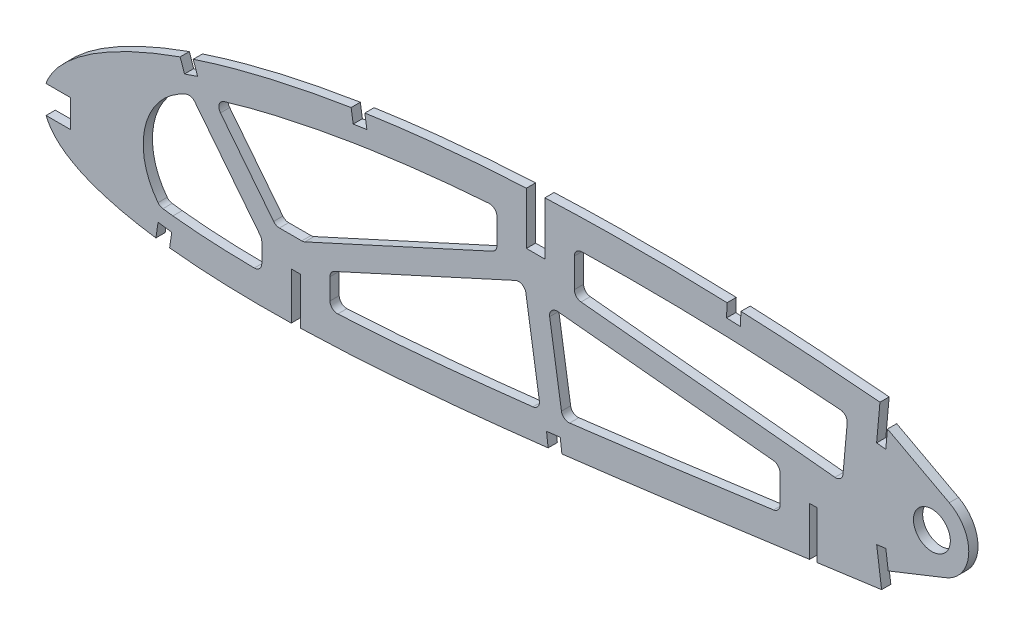
from build123d import *

# Parameters (mm, degrees)
BOSS_EXTRUDE1_DEPTH = 3.175
CUT_EXTRUDE1_DEPTH  = 7.62
SKETCH3_R           = 6.35
CUT_EXTRUDE2_DEPTH  = 7.62
CUT_EXTRUDE3_DEPTH  = 477.963187519
CUT_EXTRUDE4_START  = -3.175
CUT_EXTRUDE4_DEPTH  = 3.175
FILLET1_R           = 2.54


# Read off the part's stored shape, not the designer's step: Cut-Extrude4
with BuildPart() as part:
    # Sketch1 → Boss-Extrude1 (new body)
    with BuildSketch(Plane.XY):
        with BuildLine():
            Line((468.834634376, -0.731838708), (473.237631437, -1.626460605))
            Line((473.237631437, -1.626460605), (469.420105342, 0.731838708))
            add(Edge.make_bspline(
                [(469.420105342, 0.731838708), (469.384144743, 0.75405358), (469.240441949, 0.842826831), (468.916653521, 1.041434293), (468.377478456, 1.372225024), (467.622680377, 1.832901279), (466.652845475, 2.422239826), (465.467485908, 3.136113979), (464.067341521, 3.972204372), (462.452751187, 4.926556606), (460.623880493, 5.99470234), (458.581425768, 7.172314172), (456.325564704, 8.452725095), (453.857171213, 9.830703338), (451.177092175, 11.299695359), (448.285834578, 12.853066351), (445.184433662, 14.482914856), (441.87408004, 16.182230896), (438.355377166, 17.941630348), (434.629984045, 19.753790881), (430.699141968, 21.609677497), (426.564192467, 23.499388025), (422.22751115, 25.41521975), (417.69029685, 27.345261464), (412.955135305, 29.281151436), (408.024042449, 31.211871947), (402.899937976, 33.12863011), (397.58479872, 35.019008566), (392.082597846, 36.874746386), (386.396004495, 38.68378787), (380.529085336, 40.436308543), (374.485249168, 42.120945686), (368.269534158, 43.72905958), (361.885882446, 45.248939331), (355.339704572, 46.670411418), (348.63620397, 47.984917711), (341.781002635, 49.179334611), (334.793097003, 50.252730987), (327.784920922, 51.145614984), (320.79116359, 52.021329621), (313.807821665, 52.843983365), (306.739128647, 53.631788144), (299.591885106, 54.380308437), (292.373180531, 55.087203561), (285.090322746, 55.749422771), (277.750880063, 56.365023912), (270.361954303, 56.930518839), (262.931336863, 57.445036287), (255.466373755, 57.904053071), (247.975016147, 58.307224442), (240.464868712, 58.651738691), (232.943747029, 58.935221873), (225.419637453, 59.155962801), (217.900350262, 59.311846649), (210.394026923, 59.401893322), (202.908475182, 59.423642443), (195.451832721, 59.376704816), (188.031907868, 59.259468925), (180.656846602, 59.07032975), (173.334467891, 58.808934388), (166.072689758, 58.475396129), (158.879463115, 58.066921878), (151.76259133, 57.586114694), (144.729999608, 57.030954849), (137.789414782, 56.401294687), (130.948110641, 55.699758895), (124.213703919, 54.924439317), (117.593411838, 54.077542083), (111.094475675, 53.160727588), (104.72418742, 52.173496373), (98.489371058, 51.118700137), (92.396755747, 49.997417995), (86.452787451, 48.81293722), (80.663937566, 47.565566874), (75.036333929, 46.259048591), (69.57582504, 44.895658843), (64.288280855, 43.477893405), (59.179061403, 42.009154361), (54.253333229, 40.492773824), (49.516838534, 38.930418047), (44.973157087, 37.328010693), (40.627870346, 35.686689303), (36.484306892, 34.011510412), (32.547322707, 32.304761192), (28.819858841, 30.571644792), (25.306133953, 28.814134252), (22.008652271, 27.037153572), (18.930724245, 25.243427453), (16.07531265, 23.436287722), (13.44361768, 21.620318123), (11.039267644, 19.796658613), (8.863088517, 17.969917436), (6.916457434, 16.142876281), (5.20215694, 14.316793669), (3.720125296, 12.494885385), (2.472304781, 10.678594294), (1.458911867, 8.869639065), (0.682238714, 7.069333725), (0.141515122, 5.278690749), (-0.154473369, 3.500353053), (-0.228146672, 1.732894981), (-0.07593526, 0.576768576), (0, 0)],
                knots=[0, 0, 0, 0, 0.00025409, 0.001015373, 0.002283359, 0.004056577, 0.006330982, 0.009105274, 0.012374489, 0.016134023, 0.020379661, 0.025105976, 0.030306237, 0.035972206, 0.042099522, 0.048678064, 0.055701664, 0.063160184, 0.071045824, 0.079349827, 0.08806291, 0.097175757, 0.106678111, 0.116561573, 0.126814276, 0.137428301, 0.148393618, 0.15969976, 0.171338125, 0.183297699, 0.195569604, 0.208143556, 0.221011593, 0.234161831, 0.24758745, 0.261276822, 0.27522271, 0.289414144, 0.3037712, 0.317689226, 0.331784111, 0.346039677, 0.36044387, 0.374982721, 0.389640454, 0.404403317, 0.4192566, 0.434186749, 0.449177265, 0.464214782, 0.479284009, 0.49436974, 0.509457833, 0.524532346, 0.53957932, 0.554582984, 0.569529546, 0.584403417, 0.599190992, 0.613876838, 0.628447475, 0.642888675, 0.657186054, 0.671325546, 0.685294014, 0.699078147, 0.712665095, 0.726042645, 0.739197713, 0.752117586, 0.764792042, 0.777208152, 0.789355685, 0.80122396, 0.812803686, 0.824082909, 0.835054602, 0.845709571, 0.856037853, 0.866033834, 0.875688843, 0.884997719, 0.893953426, 0.902552897, 0.910789386, 0.918660734, 0.926166253, 0.933302626, 0.94007122, 0.94647478, 0.952517526, 0.958204819, 0.963546652, 0.9685566, 0.973249913, 0.977651041, 0.981787043, 0.985694226, 0.989415109, 0.993001157, 0.996508416, 1, 1, 1, 1], degree=3))
            add(Edge.make_bspline(
                [(0, 0), (0.120545422, -0.569054782), (0.362190271, -1.709779619), (1.018707782, -3.35195076), (1.886920844, -4.930552911), (2.985051288, -6.441392915), (4.305797565, -7.884057869), (5.846242644, -9.260048331), (7.604875869, -10.568624397), (9.57939547, -11.809190578), (11.766933151, -12.983063792), (14.165030149, -14.089514173), (16.771499867, -15.128195969), (19.583502489, -16.097720727), (22.597600275, -16.999564994), (25.810927556, -17.83153108), (29.219830482, -18.594781746), (32.82103031, -19.287368785), (36.610602861, -19.909995783), (40.584611298, -20.462314276), (44.738976581, -20.94466978), (49.069622971, -21.356050059), (53.572267018, -21.697340041), (58.242420882, -21.968766107), (63.07555133, -22.171188915), (68.067028727, -22.30383895), (73.21196449, -22.368784292), (78.505709034, -22.366999873), (83.943083827, -22.298008468), (89.519444052, -22.165621357), (95.229438588, -21.969000009), (101.06791245, -21.710523747), (107.029599259, -21.392793842), (113.109152024, -21.016887343), (119.301220533, -20.584470276), (125.600428387, -20.099010447), (132.001053313, -19.561718629), (138.497513135, -18.97572672), (145.084056477, -18.343968166), (151.754992696, -17.668442476), (158.504433487, -16.952327301), (165.326367256, -16.197943271), (172.214990615, -15.40931492), (179.164010856, -14.587869186), (186.167551809, -13.738296088), (193.219024932, -12.862218898), (200.312533746, -11.963011893), (207.44169833, -11.044909074), (214.599844565, -10.107805674), (221.780951957, -9.158378258), (228.978095261, -8.195844739), (236.185009877, -7.225155571), (243.39502444, -6.249327898), (250.601116302, -5.268662037), (257.796951099, -4.287222096), (264.975853334, -3.307702419), (272.13079123, -2.33019238), (279.255291474, -1.35955068), (286.342179994, -0.395658656), (293.38492181, 0.559529456), (300.37676799, 1.503162571), (307.311122172, 2.434049592), (314.180831105, 3.351601668), (320.978983246, 4.256163344), (327.596964914, 5.120278953), (334.01748331, 5.989962795), (340.262174398, 6.702910859), (346.429111082, 7.311437642), (352.524699362, 7.810345682), (358.541619746, 8.206812681), (364.472978221, 8.503671562), (370.311705825, 8.705066897), (376.050427401, 8.816973355), (381.681975143, 8.842230751), (387.198662126, 8.788893941), (392.593313409, 8.66126226), (397.85839984, 8.46506453), (402.98657623, 8.20692007), (407.970558399, 7.89386613), (412.802863889, 7.530520429), (417.476759125, 7.125365523), (421.985033014, 6.684332445), (426.320762922, 6.212460013), (430.477622429, 5.719635759), (434.44895803, 5.209104646), (438.228796305, 4.68925635), (441.811052689, 4.165359017), (445.190053843, 3.644101417), (448.360490845, 3.130455994), (451.317242447, 2.631240452), (454.055677032, 2.151118888), (456.571042556, 1.694780117), (458.859849552, 1.267981745), (460.917577703, 0.872844052), (462.741474942, 0.515878932), (464.328149845, 0.198661447), (465.675276413, -0.074339095), (466.780502068, -0.302045374), (467.642148233, -0.480719316), (468.258513042, -0.610646491), (468.628929808, -0.68795975), (468.793510743, -0.723066602), (468.834634376, -0.731838708)],
                knots=[0, 0, 0, 0, 0.003638255, 0.007293231, 0.011028136, 0.014901081, 0.018963272, 0.023258475, 0.027820626, 0.032679082, 0.03785316, 0.043361875, 0.049214679, 0.055422346, 0.061988786, 0.068918036, 0.076211157, 0.083868392, 0.091887411, 0.100265912, 0.108999867, 0.118084529, 0.127514843, 0.13728527, 0.147387917, 0.157816481, 0.168563473, 0.179619128, 0.190977373, 0.202626974, 0.214560478, 0.226767249, 0.239236417, 0.251959004, 0.264923894, 0.278119703, 0.291536035, 0.30516028, 0.318980685, 0.332985499, 0.34716279, 0.361498603, 0.375980747, 0.390597192, 0.405332593, 0.420174823, 0.435109533, 0.450124276, 0.465203068, 0.480333154, 0.495500583, 0.510689775, 0.525887334, 0.541078314, 0.556247233, 0.571381785, 0.58646604, 0.601484516, 0.616424329, 0.631269423, 0.646006524, 0.660620684, 0.675098188, 0.689422858, 0.703581824, 0.716907564, 0.730009274, 0.742952128, 0.755725558, 0.768319952, 0.780724337, 0.792926528, 0.804916041, 0.816679084, 0.828203524, 0.8394749, 0.850481359, 0.861207697, 0.871639326, 0.881763414, 0.891563605, 0.901027364, 0.910138977, 0.918883976, 0.927249278, 0.935221104, 0.942784738, 0.949928188, 0.956638464, 0.962904204, 0.968712288, 0.974054485, 0.978918432, 0.983297218, 0.987180246, 0.990560674, 0.993433357, 0.995790626, 0.997629587, 0.998945816, 0.999736592, 1, 1, 1, 1], degree=3))
        make_face()
    extrude(amount=BOSS_EXTRUDE1_DEPTH)

    # Sketch2 → Cut-Extrude1 (cut)
    with BuildSketch(Plane(origin=(0, 0, 0), x_dir=(-1, 0, 0), z_dir=(0, 0, -1))):
        Polygon((-263.563721968, 13.219982977), (-263.563721968, -3.189971143), (-263.563721968, -3.825357456), (-266.103721968, -4.091779691), (-266.103721968, -3.189971143), (-266.103721968, 13.219982977), align=None)
        Polygon((-166.091221968, 58.764877443), (-166.091221968, 40.486653506), (-172.441221968, 40.486653506), (-172.441221968, 58.764877443), (-172.441221968, 60.571266296), (-166.091221968, 59.668071869), align=None)
        Polygon((-85.128721968, -6.092674639), (-85.128721968, -21.703698708), (-85.128721968, -22.835129767), (-88.303721968, -23.966560826), (-88.303721968, -21.703698708), (-88.303721968, -6.092674639), align=None)
    extrude(amount=-CUT_EXTRUDE1_DEPTH, mode=Mode.SUBTRACT)

    # Sketch3 → Cut-Extrude2 (cut)
    with BuildSketch(Plane(origin=(0, 0, 0), x_dir=(-1, 0, 0), z_dir=(0, 0, -1))):
        with Locations((-305.693087566, 26.255421435)):
            Circle(SKETCH3_R)
    extrude(amount=-CUT_EXTRUDE2_DEPTH, mode=Mode.SUBTRACT)

    # Sketch5 → Cut-Extrude3 (cut, through all)
    with BuildSketch(Plane.XY.offset(3.175)):
        with BuildLine():
            add(Edge.make_bspline(
                [(173.562373408, -15.247765111), (175.141161833, -15.062948752), (176.719725799, -14.876214779), (178.298089471, -14.687803621)],
                knots=[0.378859133, 0.378859133, 0.378859133, 0.378859133, 0.388816721, 0.388816721, 0.388816721, 0.388816721], degree=3))
            Line((178.298089471, -14.687803621), (177.745349182, -10.007769829))
            Line((177.745349182, -10.007769829), (173.015722526, -10.566364959))
            Line((173.015722526, -10.566364959), (173.562373408, -15.247765111))
        make_face()
        with BuildLine():
            Line((291.522668836, 0.321351376), (290.670378201, 6.614037898))
            Line((290.670378201, 6.614037898), (289.818087566, 12.906724419))
            Line((289.818087566, 12.906724419), (286.671839619, 12.480413384))
            Line((286.671839619, 12.480413384), (288.377083759, -0.104578404))
            Line((288.377083759, -0.104578404), (288.379115861, -0.119575663))
            add(Edge.make_bspline(
                [(288.379115861, -0.119575663), (289.427603301, 0.022700847), (290.476105213, 0.164870688), (291.524625538, 0.306904526)],
                knots=[0.620684995, 0.620684995, 0.620684995, 0.620684995, 0.627313266, 0.627313266, 0.627313266, 0.627313266], degree=3))
            Line((291.524625538, 0.306904526), (291.522668836, 0.321351376))
        make_face()
        with BuildLine():
            Line((295.598618472, -29.772459684), (291.524625538, 0.306904526))
            add(Edge.make_bspline(
                [(288.379115861, -0.119575663), (289.427603301, 0.022700847), (290.476105213, 0.164870688), (291.524625538, 0.306904526)],
                knots=[0.620684995, 0.620684995, 0.620684995, 0.620684995, 0.627313266, 0.627313266, 0.627313266, 0.627313266], degree=3))
            Line((288.379115861, -0.119575663), (292.454749933, -30.198448314))
            Line((292.454749933, -30.198448314), (295.598618472, -29.772459684))
        make_face()
        Polygon((287.805580476, 55.427217406), (290.974350563, 55.134262556), (289.818087566, 42.492582353), (286.656261254, 42.779912158), align=None)
        with BuildLine():
            Line((239.754783505, 54.035005433), (239.951763596, 58.662782032))
            add(Edge.make_bspline(
                [(239.951763596, 58.662782032), (238.357272837, 58.728511146), (236.762610892, 58.790091471), (235.167797583, 58.847466722)],
                knots=[0.480317671, 0.480317671, 0.480317671, 0.480317671, 0.489910692, 0.489910692, 0.489910692, 0.489910692], degree=3))
            Line((235.167797583, 58.847466722), (234.996325816, 54.224865184))
            Line((234.996325816, 54.224865184), (239.754783505, 54.035005433))
        make_face()
        with BuildLine():
            Line((9.06978408, 6.971559138), (0.685322727, 6.971559138))
            add(Edge.make_bspline(
                [(0.685322727, 6.971559138), (0.482389044, 6.407374475), (0.138253158, 5.259092442), (-0.154473369, 3.500353053), (-0.228146672, 1.732894981), (-0.07593526, 0.576768576), (0, 0)],
                knots=[0.985813405, 0.985813405, 0.985813405, 0.985813405, 0.989415109, 0.993001157, 0.996508416, 1, 1, 1, 1], degree=3))
            add(Edge.make_bspline(
                [(0, 0), (0.120545422, -0.569054782), (0.30412641, -1.435679474), (0.598828773, -2.270728171), (0.710777244, -2.553440862)],
                knots=[0, 0, 0, 0, 0.003638255, 0.00554077, 0.00554077, 0.00554077, 0.00554077], degree=3))
            Line((0.710777244, -2.553440862), (9.06978408, -2.553440862))
            Line((9.06978408, -2.553440862), (9.06978408, 6.971559138))
        make_face()
        with BuildLine():
            Line((52.870060284, 35.183871976), (51.376326419, 39.538786779))
            add(Edge.make_bspline(
                [(51.376326419, 39.538786779), (50.739517722, 39.327249846), (49.234918009, 38.820586637), (47.735400257, 38.299011605), (46.871554192, 37.992597478)],
                knots=[0.8620002, 0.8620002, 0.8620002, 0.8620002, 0.866033834, 0.871543542, 0.871543542, 0.871543542, 0.871543542], degree=3))
            Line((46.871554192, 37.992597478), (48.365353707, 33.638606688))
            Line((48.365353707, 33.638606688), (52.870060284, 35.183871976))
        make_face()
        with BuildLine():
            Line((38.580138186, -19.810848003), (38.52701999, -20.172343471))
            add(Edge.make_bspline(
                [(38.52701999, -20.172343471), (39.194238836, -20.265410841), (40.763736641, -20.474800673), (42.335834458, -20.663697889), (43.239763342, -20.765931858)],
                knots=[0.096045863, 0.096045863, 0.096045863, 0.096045863, 0.100265912, 0.105964413, 0.105964413, 0.105964413, 0.105964413], degree=3))
            Line((43.239763342, -20.765931858), (43.273642918, -20.537153369))
            Line((43.273642918, -20.537153369), (43.979030381, -15.773886043))
            Line((43.979030381, -15.773886043), (39.275075578, -15.081456991))
            Line((39.275075578, -15.081456991), (38.580138186, -19.810848003))
        make_face()
        with BuildLine():
            add(Edge.make_bspline(
                [(38.52701999, -20.172343471), (39.194238836, -20.265410841), (40.763736641, -20.474800673), (42.335834458, -20.663697889), (43.239763342, -20.765931858)],
                knots=[0.096045863, 0.096045863, 0.096045863, 0.096045863, 0.100265912, 0.105964413, 0.105964413, 0.105964413, 0.105964413], degree=3))
            Line((38.52701999, -20.172343471), (38.160799257, -22.664655821))
            Line((38.160799257, -22.664655821), (42.8564058, -23.354628919))
            Line((42.8564058, -23.354628919), (43.239763342, -20.765931858))
        make_face()
        with BuildLine():
            Line((111.155939725, 48.452533591), (110.465649645, 53.052319459))
            add(Edge.make_bspline(
                [(110.465649645, 53.052319459), (108.88681405, 52.816503777), (107.30916199, 52.572756358), (105.732808579, 52.320876195)],
                knots=[0.740397541, 0.740397541, 0.740397541, 0.740397541, 0.749993548, 0.749993548, 0.749993548, 0.749993548], degree=3))
            Line((105.732808579, 52.320876195), (106.446205739, 47.745712654))
            Line((106.446205739, 47.745712654), (111.155939725, 48.452533591))
        make_face()
        with BuildLine():
            Line((288.176136312, 59.504877188), (287.812137668, 55.499373873))
            add(Edge.make_bspline(
                [(469.420105342, 0.731838708), (469.384144743, 0.75405358), (469.240441949, 0.842826831), (468.916653521, 1.041434293), (468.377478456, 1.372225024), (467.622680377, 1.832901279), (466.652845475, 2.422239826), (465.467485908, 3.136113979), (464.067341521, 3.972204372), (462.452751187, 4.926556606), (460.623880493, 5.99470234), (458.581425768, 7.172314172), (456.325564704, 8.452725095), (453.857171213, 9.830703338), (451.177092175, 11.299695359), (448.285834578, 12.853066351), (445.184433662, 14.482914856), (441.87408004, 16.182230896), (438.355377166, 17.941630348), (434.629984045, 19.753790881), (430.699141968, 21.609677497), (426.564192467, 23.499388025), (422.22751115, 25.41521975), (417.69029685, 27.345261464), (412.955135305, 29.281151436), (408.024042449, 31.211871947), (402.899937976, 33.12863011), (397.58479872, 35.019008566), (392.082597846, 36.874746386), (386.396004495, 38.68378787), (380.529085336, 40.436308543), (374.485249168, 42.120945686), (368.269534158, 43.72905958), (361.885882446, 45.248939331), (355.339704572, 46.670411418), (348.63620397, 47.984917711), (341.781002635, 49.179334611), (334.793097003, 50.252730987), (327.784920922, 51.145614984), (320.79116359, 52.021329621), (313.807821665, 52.843983365), (306.739128647, 53.631788144), (299.591885106, 54.380308437), (293.274130988, 54.998977554), (289.339090424, 55.361913829), (287.812137668, 55.499373873)],
                knots=[0, 0, 0, 0, 0.00025409, 0.001015373, 0.002283359, 0.004056577, 0.006330982, 0.009105274, 0.012374489, 0.016134023, 0.020379661, 0.025105976, 0.030306237, 0.035972206, 0.042099522, 0.048678064, 0.055701664, 0.063160184, 0.071045824, 0.079349827, 0.08806291, 0.097175757, 0.106678111, 0.116561573, 0.126814276, 0.137428301, 0.148393618, 0.15969976, 0.171338125, 0.183297699, 0.195569604, 0.208143556, 0.221011593, 0.234161831, 0.24758745, 0.261276822, 0.27522271, 0.289414144, 0.3037712, 0.317689226, 0.331784111, 0.346039677, 0.36044387, 0.374982721, 0.384198738, 0.384198738, 0.384198738, 0.384198738], degree=3))
            Line((469.420105342, 0.731838708), (473.237631437, -1.626460605))
            Line((473.237631437, -1.626460605), (468.834634376, -0.731838708))
            add(Edge.make_bspline(
                [(291.524625538, 0.306904526), (292.150446481, 0.391678991), (295.10754742, 0.792018348), (300.37676799, 1.503162571), (307.311122172, 2.434049592), (314.180831105, 3.351601668), (320.978983246, 4.256163344), (327.596964914, 5.120278953), (334.01748331, 5.989962795), (340.262174398, 6.702910859), (346.429111082, 7.311437642), (352.524699362, 7.810345682), (358.541619746, 8.206812681), (364.472978221, 8.503671562), (370.311705825, 8.705066897), (376.050427401, 8.816973355), (381.681975143, 8.842230751), (387.198662126, 8.788893941), (392.593313409, 8.66126226), (397.85839984, 8.46506453), (402.98657623, 8.20692007), (407.970558399, 7.89386613), (412.802863889, 7.530520429), (417.476759125, 7.125365523), (421.985033014, 6.684332445), (426.320762922, 6.212460013), (430.477622429, 5.719635759), (434.44895803, 5.209104646), (438.228796305, 4.68925635), (441.811052689, 4.165359017), (445.190053843, 3.644101417), (448.360490845, 3.130455994), (451.317242447, 2.631240452), (454.055677032, 2.151118888), (456.571042556, 1.694780117), (458.859849552, 1.267981745), (460.917577703, 0.872844052), (462.741474942, 0.515878932), (464.328149845, 0.198661447), (465.675276413, -0.074339095), (466.780502068, -0.302045374), (467.642148233, -0.480719316), (468.258513042, -0.610646491), (468.628929808, -0.68795975), (468.793510743, -0.723066602), (468.834634376, -0.731838708)],
                knots=[0.627313266, 0.627313266, 0.627313266, 0.627313266, 0.631269423, 0.646006524, 0.660620684, 0.675098188, 0.689422858, 0.703581824, 0.716907564, 0.730009274, 0.742952128, 0.755725558, 0.768319952, 0.780724337, 0.792926528, 0.804916041, 0.816679084, 0.828203524, 0.8394749, 0.850481359, 0.861207697, 0.871639326, 0.881763414, 0.891563605, 0.901027364, 0.910138977, 0.918883976, 0.927249278, 0.935221104, 0.942784738, 0.949928188, 0.956638464, 0.962904204, 0.968712288, 0.974054485, 0.978918432, 0.983297218, 0.987180246, 0.990560674, 0.993433357, 0.995790626, 0.997629587, 0.998945816, 0.999736592, 1, 1, 1, 1], degree=3))
            Line((291.524625538, 0.306904526), (295.598618472, -29.772459684))
            Line((295.598618472, -29.772459684), (511.589197516, -29.772459684))
            Line((511.589197516, -29.772459684), (511.589197516, 59.504877188))
            Line((511.589197516, 59.504877188), (288.176136312, 59.504877188))
        make_face()
        with BuildLine():
            Line((290.974350563, 55.134262556), (290.396219065, 48.813422454))
            Line((290.396219065, 48.813422454), (311.672156685, 37.459917518))
            ThreePointArc((311.672156685, 37.459917518), (316.584005291, 32.788254748), (318.393087566, 26.255421435))
            ThreePointArc((318.393087566, 26.255421435), (316.202371282, 19.124856535), (310.386007915, 14.454298666))
            Line((310.386007915, 14.454298666), (290.670378201, 6.614037898))
            Line((290.670378201, 6.614037898), (291.522668836, 0.321351376))
            Line((291.522668836, 0.321351376), (291.524625538, 0.306904526))
            add(Edge.make_bspline(
                [(291.524625538, 0.306904526), (292.150446481, 0.391678991), (295.10754742, 0.792018348), (300.37676799, 1.503162571), (307.311122172, 2.434049592), (314.180831105, 3.351601668), (320.978983246, 4.256163344), (327.596964914, 5.120278953), (334.01748331, 5.989962795), (340.262174398, 6.702910859), (346.429111082, 7.311437642), (352.524699362, 7.810345682), (358.541619746, 8.206812681), (364.472978221, 8.503671562), (370.311705825, 8.705066897), (376.050427401, 8.816973355), (381.681975143, 8.842230751), (387.198662126, 8.788893941), (392.593313409, 8.66126226), (397.85839984, 8.46506453), (402.98657623, 8.20692007), (407.970558399, 7.89386613), (412.802863889, 7.530520429), (417.476759125, 7.125365523), (421.985033014, 6.684332445), (426.320762922, 6.212460013), (430.477622429, 5.719635759), (434.44895803, 5.209104646), (438.228796305, 4.68925635), (441.811052689, 4.165359017), (445.190053843, 3.644101417), (448.360490845, 3.130455994), (451.317242447, 2.631240452), (454.055677032, 2.151118888), (456.571042556, 1.694780117), (458.859849552, 1.267981745), (460.917577703, 0.872844052), (462.741474942, 0.515878932), (464.328149845, 0.198661447), (465.675276413, -0.074339095), (466.780502068, -0.302045374), (467.642148233, -0.480719316), (468.258513042, -0.610646491), (468.628929808, -0.68795975), (468.793510743, -0.723066602), (468.834634376, -0.731838708)],
                knots=[0.627313266, 0.627313266, 0.627313266, 0.627313266, 0.631269423, 0.646006524, 0.660620684, 0.675098188, 0.689422858, 0.703581824, 0.716907564, 0.730009274, 0.742952128, 0.755725558, 0.768319952, 0.780724337, 0.792926528, 0.804916041, 0.816679084, 0.828203524, 0.8394749, 0.850481359, 0.861207697, 0.871639326, 0.881763414, 0.891563605, 0.901027364, 0.910138977, 0.918883976, 0.927249278, 0.935221104, 0.942784738, 0.949928188, 0.956638464, 0.962904204, 0.968712288, 0.974054485, 0.978918432, 0.983297218, 0.987180246, 0.990560674, 0.993433357, 0.995790626, 0.997629587, 0.998945816, 0.999736592, 1, 1, 1, 1], degree=3))
            Line((468.834634376, -0.731838708), (473.237631437, -1.626460605))
            Line((473.237631437, -1.626460605), (469.420105342, 0.731838708))
            add(Edge.make_bspline(
                [(469.420105342, 0.731838708), (469.384144743, 0.75405358), (469.240441949, 0.842826831), (468.916653521, 1.041434293), (468.377478456, 1.372225024), (467.622680377, 1.832901279), (466.652845475, 2.422239826), (465.467485908, 3.136113979), (464.067341521, 3.972204372), (462.452751187, 4.926556606), (460.623880493, 5.99470234), (458.581425768, 7.172314172), (456.325564704, 8.452725095), (453.857171213, 9.830703338), (451.177092175, 11.299695359), (448.285834578, 12.853066351), (445.184433662, 14.482914856), (441.87408004, 16.182230896), (438.355377166, 17.941630348), (434.629984045, 19.753790881), (430.699141968, 21.609677497), (426.564192467, 23.499388025), (422.22751115, 25.41521975), (417.69029685, 27.345261464), (412.955135305, 29.281151436), (408.024042449, 31.211871947), (402.899937976, 33.12863011), (397.58479872, 35.019008566), (392.082597846, 36.874746386), (386.396004495, 38.68378787), (380.529085336, 40.436308543), (374.485249168, 42.120945686), (368.269534158, 43.72905958), (361.885882446, 45.248939331), (355.339704572, 46.670411418), (348.63620397, 47.984917711), (341.781002635, 49.179334611), (334.793097003, 50.252730987), (327.784920922, 51.145614984), (320.79116359, 52.021329621), (313.807821665, 52.843983365), (306.739128647, 53.631788144), (299.591885106, 54.380308437), (293.274130988, 54.998977554), (289.339090424, 55.361913829), (287.812137668, 55.499373873)],
                knots=[0, 0, 0, 0, 0.00025409, 0.001015373, 0.002283359, 0.004056577, 0.006330982, 0.009105274, 0.012374489, 0.016134023, 0.020379661, 0.025105976, 0.030306237, 0.035972206, 0.042099522, 0.048678064, 0.055701664, 0.063160184, 0.071045824, 0.079349827, 0.08806291, 0.097175757, 0.106678111, 0.116561573, 0.126814276, 0.137428301, 0.148393618, 0.15969976, 0.171338125, 0.183297699, 0.195569604, 0.208143556, 0.221011593, 0.234161831, 0.24758745, 0.261276822, 0.27522271, 0.289414144, 0.3037712, 0.317689226, 0.331784111, 0.346039677, 0.36044387, 0.374982721, 0.384198738, 0.384198738, 0.384198738, 0.384198738], degree=3))
            Line((287.812137668, 55.499373873), (287.805580476, 55.427217406))
            Line((287.805580476, 55.427217406), (290.974350563, 55.134262556))
        make_face()
    extrude(amount=-CUT_EXTRUDE3_DEPTH, mode=Mode.SUBTRACT)

    # Cut-Extrude4 outline → Cut-Extrude4 (cut)
    with BuildSketch(Plane.XY.offset(3.175).offset(CUT_EXTRUDE4_START)):
        with BuildLine():
            Line((39.930604472, -10.109761764), (44.38157543, -10.670295912))
            add(Edge.make_bspline(
                [(44.38157543, -10.670295912), (46.034662696, -10.857259371), (49.337139028, -11.186158972), (56.025649263, -11.698106406), (63.738395649, -12.057811627), (70.634646254, -12.185558432), (74.141296341, -12.202897715), (74.968721968, -12.204430721)],
                knots=[0.105964413, 0.105964413, 0.105964413, 0.105964413, 0.116912747, 0.12786108, 0.149757748, 0.166981262, 0.172295226, 0.172295226, 0.172295226, 0.172295226], degree=3))
            Line((74.968721968, -12.204430721), (74.968721968, -2.081775436))
            Line((74.968721968, -2.081775436), (50.759969678, 28.585978035))
            Line((50.759969678, 28.585978035), (50.268056558, 28.417140743))
            ThreePointArc((50.268056558, 28.417140743), (34.975017295, 11.870222509), (39.930604472, -10.109761764))
        make_face()
        with BuildLine():
            Line((98.463721968, -0.121589375), (98.463721968, -11.653138899))
            add(Edge.make_bspline(
                [(98.463721968, -11.653138899), (99.334257342, -11.613567267), (102.862109957, -11.445749182), (113.410039355, -10.857806213), (130.129315594, -9.5921333), (150.766870083, -7.600934902), (164.387263433, -6.087045578), (170.950958683, -5.323557338)],
                knots=[0.222376206, 0.222376206, 0.222376206, 0.222376206, 0.227924587, 0.244851792, 0.289520906, 0.334190019, 0.375834307, 0.375834307, 0.375834307, 0.375834307], degree=3))
            Line((170.950958683, -5.323557338), (165.904844317, 27.145696631))
            ThreePointArc((165.904844317, 27.145696631), (164.599324709, 28.991955067), (162.339327402, 29.065872817))
            Line((162.339327402, 29.065872817), (98.463721968, -0.121589375))
        make_face()
        with BuildLine():
            Line((111.966503767, 43.003785391), (107.335904552, 42.288145594))
            add(Edge.make_bspline(
                [(107.335904552, 42.288145594), (102.842983654, 41.570237008), (93.867737298, 39.997372509), (80.55350511, 37.195884127), (69.604127653, 34.442784918), (62.270628135, 32.327077752), (59.288685621, 31.409201537), (58.44761479, 31.14543712)],
                knots=[0.749993548, 0.749993548, 0.749993548, 0.749993548, 0.777995211, 0.805996874, 0.833998537, 0.847999368, 0.853516781, 0.853516781, 0.853516781, 0.853516781], degree=3))
            Line((58.44761479, 31.14543712), (79.822747488, 4.067325361))
            Line((79.822747488, 4.067325361), (89.296447913, 4.067325361))
            Line((89.296447913, 4.067325361), (155.931221968, 34.515568242))
            Line((155.931221968, 34.515568242), (155.931221968, 47.681289119))
            add(Edge.make_bspline(
                [(155.931221968, 47.681289119), (155.042001778, 47.621064238), (153.264096066, 47.496885636), (147.674819815, 47.082061418), (138.419490186, 46.287555619), (125.527116952, 44.895297911), (116.48214886, 43.678244422), (111.966503767, 43.003785391)],
                knots=[0.650140852, 0.650140852, 0.650140852, 0.650140852, 0.655583943, 0.661027034, 0.684383015, 0.712390278, 0.740397541, 0.740397541, 0.740397541, 0.740397541], degree=3))
        make_face()
        with BuildLine():
            Line((239.533297003, 48.51140352), (234.802516149, 48.694035308))
            add(Edge.make_bspline(
                [(234.802516149, 48.694035308), (229.637519532, 48.879852028), (219.301469579, 49.162297923), (203.807906853, 49.303025408), (192.386332598, 49.186342176), (185.321432595, 49.025096544), (183.412681918, 48.974071195), (182.601221968, 48.951018713)],
                knots=[0.489910692, 0.489910692, 0.489910692, 0.489910692, 0.521340724, 0.552770756, 0.584200788, 0.590890378, 0.595838466, 0.595838466, 0.595838466, 0.595838466], degree=3))
            Line((182.601221968, 48.951018713), (182.601221968, 34.154947553))
            Line((182.601221968, 34.154947553), (274.848130569, 25.104294238))
            Line((274.848130569, 25.104294238), (276.769017384, 46.242061215))
            add(Edge.make_bspline(
                [(276.769017384, 46.242061215), (276.202312052, 46.287427406), (271.690025425, 46.644838533), (263.229176852, 47.257973718), (251.382975282, 47.971220857), (243.484209279, 48.348536497), (239.533297003, 48.51140352)],
                knots=[0.404776872, 0.404776872, 0.404776872, 0.404776872, 0.408228471, 0.432258204, 0.456287938, 0.480317671, 0.480317671, 0.480317671, 0.480317671], degree=3))
        make_face()
        with BuildLine():
            Line((173.579356493, 27.383524912), (178.523302718, -4.428327522))
            add(Edge.make_bspline(
                [(178.523302718, -4.428327522), (178.642427342, -4.414031084), (185.250433801, -3.620458964), (198.940263177, -1.914653537), (219.614728992, 0.791015504), (237.235114424, 3.16600902), (248.501098681, 4.699216776), (252.671611456, 5.267849071), (253.403721968, 5.367688807)],
                knots=[0.39183634, 0.39183634, 0.39183634, 0.39183634, 0.392591245, 0.433709801, 0.478602881, 0.523495961, 0.545240844, 0.549870484, 0.549870484, 0.549870484, 0.549870484], degree=3))
            Line((253.403721968, 5.367688807), (253.403721968, 19.55168893))
            Line((253.403721968, 19.55168893), (173.579356493, 27.383524912))
        make_face()
    extrude(amount=CUT_EXTRUDE4_DEPTH, mode=Mode.SUBTRACT)

    # Fillet1
    fillet1_edges = [part.edges().sort_by_distance(p)[0] for p in [
        (253.403721968, 5.367688807, 1.5875),
        (253.403721968, 19.55168893, 1.5875),
        (274.848130569, 25.104294238, 1.5875),
        (276.769017384, 46.242061215, 1.5875),
        (170.950958683, -5.323557338, 1.5875),
        (178.523302718, -4.428327522, 1.5875),
        (155.931221968, 34.515568242, 1.5875),
        (155.931221968, 47.681289119, 1.5875),
        (182.601221968, 48.951018713, 1.5875),
        (182.601221968, 34.154947553, 1.5875),
        (173.579356493, 27.383524912, 1.5875),
        (58.44761479, 31.14543712, 1.5875),
        (50.759969678, 28.585978035, 1.5875),
        (98.463721968, -11.653138899, 1.5875),
        (98.463721968, -0.121589375, 1.5875),
        (89.296447913, 4.067325361, 1.5875),
        (79.822747488, 4.067325361, 1.5875),
        (74.968721968, -2.081775436, 1.5875),
        (74.968721968, -12.204430721, 1.5875),
        (39.930604472, -10.109761764, 1.5875),
    ]]
    fillet(fillet1_edges, radius=FILLET1_R)


solid = part.part
